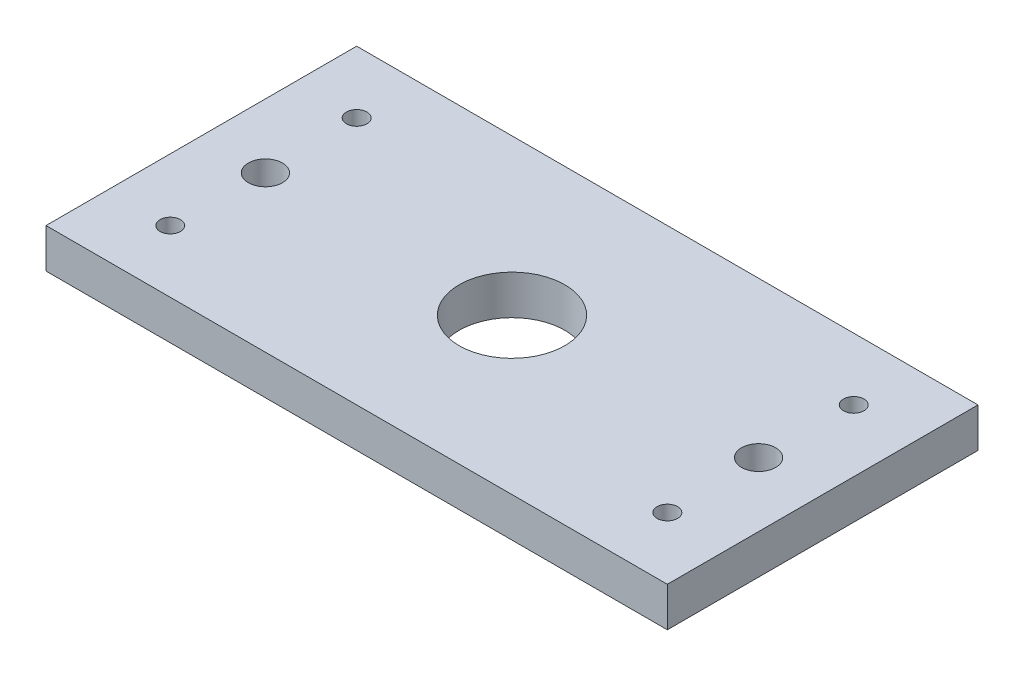
from build123d import *

# Parameters (mm, degrees)
SKETCH1_W           = 100
SKETCH1_H           = 50
SKETCH1_R           = 8.5
SKETCH1_R_2         = 2.75
SKETCH1_R_3         = 1.65
BOSS_EXTRUDE1_DEPTH = 6.35


with BuildPart() as part:
    # Sketch1 → Boss-Extrude1 (new body)
    with BuildSketch(Plane(origin=(0, 0, 0), x_dir=(1, 0, 0), z_dir=(0, 1, 0))):
        Rectangle(SKETCH1_W, SKETCH1_H)
        Circle(SKETCH1_R, mode=Mode.SUBTRACT)
        with Locations((-39.6875, 0)):
            Circle(SKETCH1_R_2, mode=Mode.SUBTRACT)
        with Locations((-40, 15)):
            Circle(SKETCH1_R_3, mode=Mode.SUBTRACT)
        with Locations((-40, -15)):
            Circle(SKETCH1_R_3, mode=Mode.SUBTRACT)
        with Locations((40, 15)):
            Circle(SKETCH1_R_3, mode=Mode.SUBTRACT)
        with Locations((39.6875, 0)):
            Circle(SKETCH1_R_2, mode=Mode.SUBTRACT)
        with Locations((40, -15)):
            Circle(SKETCH1_R_3, mode=Mode.SUBTRACT)
    extrude(amount=BOSS_EXTRUDE1_DEPTH)


solid = part.part
